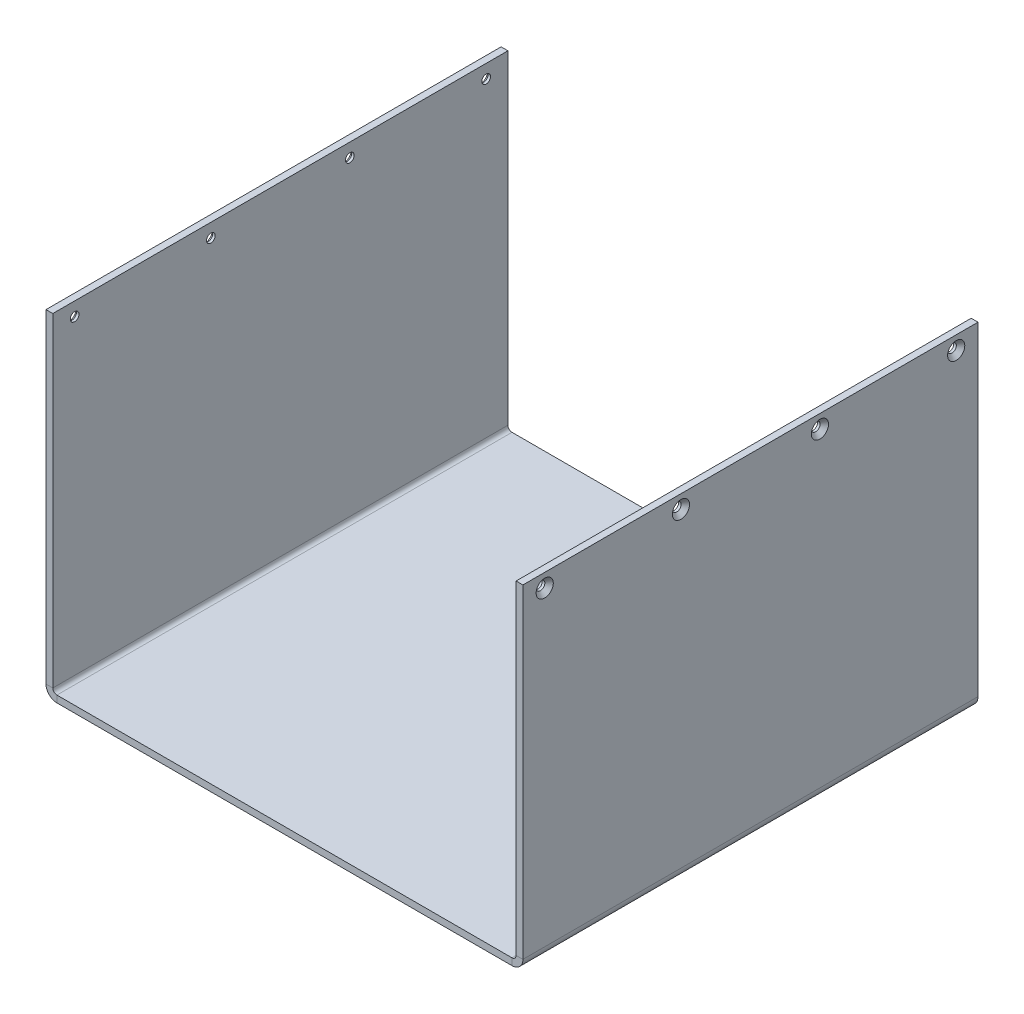
from build123d import *

# Parameters (mm, degrees)
SKETCH_238_W                                   = 170
SKETCH_238_H                                   = 167
BASE_FLANGE1_DEPTH                             = 2.5
EDGE_FLANGE1_STRIP_W                           = 13
EDGE_FLANGE1_STRIP_H                           = 2.5
EDGE_FLANGE1_STRIP_CUT_DEPTH                   = 167
EDGE_FLANGE1_DEPTH                             = 167
EDGE_FLANGE2_STRIP_W                           = 13
EDGE_FLANGE2_STRIP_H                           = 2.5
EDGE_FLANGE2_STRIP_CUT_DEPTH                   = 167
EDGE_FLANGE2_DEPTH                             = 167
CSK_FOR_M3_FLAT_HEAD_MACHINE_SCREW1_AT_2_COUNT = 2
CSK_FOR_M3_FLAT_HEAD_MACHINE_SCREW1_AT_2_PITCH = 50
CSK_FOR_M3_FLAT_HEAD_MACHINE_SCREW1_AT_3_COUNT = 2
CSK_FOR_M3_FLAT_HEAD_MACHINE_SCREW1_AT_3_PITCH = 101
CSK_FOR_M3_FLAT_HEAD_MACHINE_SCREW1_AT_4_COUNT = 2
CSK_FOR_M3_FLAT_HEAD_MACHINE_SCREW1_AT_4_PITCH = 151
CSK_FOR_M3_FLAT_HEAD_MACHINE_SCREW2_AT_2_COUNT = 2
CSK_FOR_M3_FLAT_HEAD_MACHINE_SCREW2_AT_2_PITCH = 50
CSK_FOR_M3_FLAT_HEAD_MACHINE_SCREW2_AT_3_COUNT = 2
CSK_FOR_M3_FLAT_HEAD_MACHINE_SCREW2_AT_3_PITCH = 101
CSK_FOR_M3_FLAT_HEAD_MACHINE_SCREW2_AT_4_COUNT = 2
CSK_FOR_M3_FLAT_HEAD_MACHINE_SCREW2_AT_4_PITCH = 151


# Sheet-metal steps are written as plain solids
with BuildPart() as part:
    # Sketch 238 → Base-Flange1 (new body)
    with BuildSketch(Plane(origin=(0, 0, 0), x_dir=(1, 0, 0), z_dir=(0, 1, 0))):
        with Locations((37.231404959, -52.766528926)):
            Rectangle(SKETCH_238_W, SKETCH_238_H)
    extrude(amount=-BASE_FLANGE1_DEPTH)

    # Edge-Flange1 strip (across the edge) → Edge-Flange1 strip cut (cut)
    with BuildSketch(Plane(origin=(-47.768595041, 0, -30.733471074), x_dir=(1, 0, 0), z_dir=(0, 0, 1))):
        with Locations((-5, -1.25)):
            Rectangle(EDGE_FLANGE1_STRIP_W, EDGE_FLANGE1_STRIP_H)
    extrude(amount=EDGE_FLANGE1_STRIP_CUT_DEPTH, mode=Mode.SUBTRACT)

    # Edge-Flange1 section (across the edge) → Edge-Flange1 (add)
    with BuildSketch(Plane(origin=(-47.768595041, 0, -30.733471074), x_dir=(1, 0, 0), z_dir=(0, 0, 1))):
        with BuildLine():
            Line((-2.5, 1.5), (-2.5, 120.5))
            Line((-2.5, 120.5), (0, 120.5))
            Line((0, 120.5), (0, 1.5))
            ThreePointArc((0, 1.5), (0.439339828, 0.439339828), (1.5, 0))
            Line((1.5, 0), (1.5, -2.5))
            ThreePointArc((1.5, -2.5), (-1.328427125, -1.328427125), (-2.5, 1.5))
        make_face()
    extrude(amount=EDGE_FLANGE1_DEPTH)

    # Edge-Flange2 strip (across the edge) → Edge-Flange2 strip cut (cut)
    with BuildSketch(Plane(origin=(122.231404959, 0, 136.266528926), x_dir=(-1, 0, 0), z_dir=(0, 0, -1))):
        with Locations((-5, -1.25)):
            Rectangle(EDGE_FLANGE2_STRIP_W, EDGE_FLANGE2_STRIP_H)
    extrude(amount=EDGE_FLANGE2_STRIP_CUT_DEPTH, mode=Mode.SUBTRACT)

    # Edge-Flange2 section (across the edge) → Edge-Flange2 (add)
    with BuildSketch(Plane(origin=(122.231404959, 0, 136.266528926), x_dir=(-1, 0, 0), z_dir=(0, 0, -1))):
        with BuildLine():
            Line((-2.5, 1.5), (-2.5, 120.5))
            Line((-2.5, 120.5), (0, 120.5))
            Line((0, 120.5), (0, 1.5))
            ThreePointArc((0, 1.5), (0.439339828, 0.439339828), (1.5, 0))
            Line((1.5, 0), (1.5, -2.5))
            ThreePointArc((1.5, -2.5), (-1.328427125, -1.328427125), (-2.5, 1.5))
        make_face()
    extrude(amount=EDGE_FLANGE2_DEPTH)

    # Sketch13 → CSK for M3 Flat Head Machine Screw1 (revolve, cut)
    with BuildSketch(Plane(origin=(-50.268595041, 115.5, 128.266528926), x_dir=(0, 0, 1), z_dir=(0, 1, 0))):
        Polygon((0, 0), (0, 2.5), (1.6, 2.5), (1.6, 1.55), (3.15, 0), align=None)
    csk_for_m3_flat_head_machine_screw1 = revolve(axis=Axis((-56.618595041, 115.5, 128.266528926), (1, 0, 0)), mode=Mode.SUBTRACT)

    # CSK for M3 Flat Head Machine Screw1 at 2: CSK for M3 Flat Head Machine Screw1 ×2
    with Locations(*[(0, 0, -i * CSK_FOR_M3_FLAT_HEAD_MACHINE_SCREW1_AT_2_PITCH) for i in range(1, CSK_FOR_M3_FLAT_HEAD_MACHINE_SCREW1_AT_2_COUNT)]):
        add(csk_for_m3_flat_head_machine_screw1, mode=Mode.SUBTRACT)

    # CSK for M3 Flat Head Machine Screw1 at 3: CSK for M3 Flat Head Machine Screw1 ×2
    with Locations(*[(0, 0, -i * CSK_FOR_M3_FLAT_HEAD_MACHINE_SCREW1_AT_3_PITCH) for i in range(1, CSK_FOR_M3_FLAT_HEAD_MACHINE_SCREW1_AT_3_COUNT)]):
        add(csk_for_m3_flat_head_machine_screw1, mode=Mode.SUBTRACT)

    # CSK for M3 Flat Head Machine Screw1 at 4: CSK for M3 Flat Head Machine Screw1 ×2
    with Locations(*[(0, 0, -i * CSK_FOR_M3_FLAT_HEAD_MACHINE_SCREW1_AT_4_PITCH) for i in range(1, CSK_FOR_M3_FLAT_HEAD_MACHINE_SCREW1_AT_4_COUNT)]):
        add(csk_for_m3_flat_head_machine_screw1, mode=Mode.SUBTRACT)

    # Sketch15 → CSK for M3 Flat Head Machine Screw2 (revolve, cut)
    with BuildSketch(Plane(origin=(124.731404959, 115.5, -22.733471074), x_dir=(0, 0, -1), z_dir=(0, 1, 0))):
        Polygon((0, 0), (0, 2.5), (1.6, 2.5), (1.6, 1.55), (3.15, 0), align=None)
    csk_for_m3_flat_head_machine_screw2 = revolve(axis=Axis((131.081404959, 115.5, -22.733471074), (-1, 0, 0)), mode=Mode.SUBTRACT)

    # CSK for M3 Flat Head Machine Screw2 at 2: CSK for M3 Flat Head Machine Screw2 ×2
    with Locations(*[(0, 0, i * CSK_FOR_M3_FLAT_HEAD_MACHINE_SCREW2_AT_2_PITCH) for i in range(1, CSK_FOR_M3_FLAT_HEAD_MACHINE_SCREW2_AT_2_COUNT)]):
        add(csk_for_m3_flat_head_machine_screw2, mode=Mode.SUBTRACT)

    # CSK for M3 Flat Head Machine Screw2 at 3: CSK for M3 Flat Head Machine Screw2 ×2
    with Locations(*[(0, 0, i * CSK_FOR_M3_FLAT_HEAD_MACHINE_SCREW2_AT_3_PITCH) for i in range(1, CSK_FOR_M3_FLAT_HEAD_MACHINE_SCREW2_AT_3_COUNT)]):
        add(csk_for_m3_flat_head_machine_screw2, mode=Mode.SUBTRACT)

    # CSK for M3 Flat Head Machine Screw2 at 4: CSK for M3 Flat Head Machine Screw2 ×2
    with Locations(*[(0, 0, i * CSK_FOR_M3_FLAT_HEAD_MACHINE_SCREW2_AT_4_PITCH) for i in range(1, CSK_FOR_M3_FLAT_HEAD_MACHINE_SCREW2_AT_4_COUNT)]):
        add(csk_for_m3_flat_head_machine_screw2, mode=Mode.SUBTRACT)


solid = part.part
